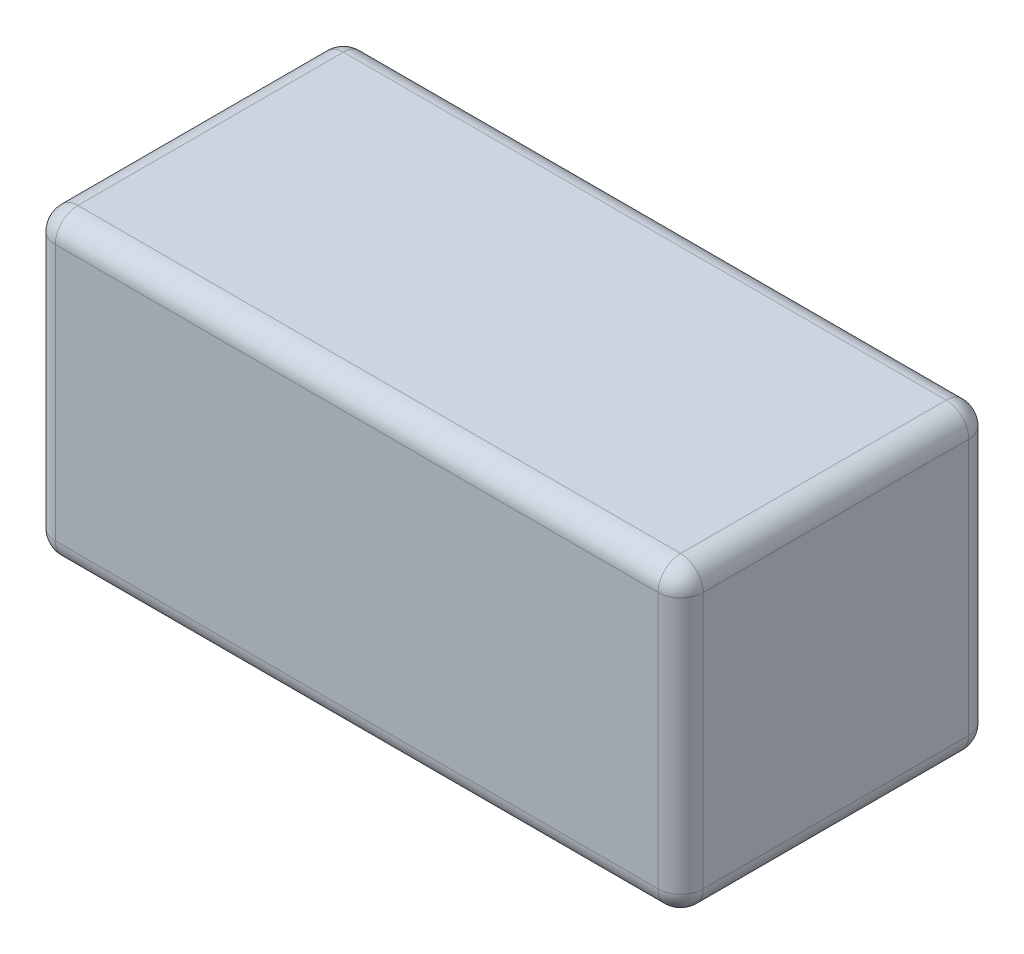
from build123d import *

# Parameters (mm, degrees)
SKETCH1_W           = 73
SKETCH1_H           = 34
BOSS_EXTRUDE1_DEPTH = 35
FILLET1_R           = 2.54


with BuildPart() as part:
    # Sketch1 → Boss-Extrude1 (new body)
    with BuildSketch(Plane.XY):
        Rectangle(SKETCH1_W, SKETCH1_H)
    extrude(amount=BOSS_EXTRUDE1_DEPTH)

    # Fillet1
    fillet1_edges = [part.edges().sort_by_distance(p)[0] for p in [
        (-36.5, 0, 0),
        (-36.5, -17, 17.5),
        (0, -17, 0),
        (36.5, -17, 17.5),
        (36.5, 0, 0),
        (36.5, 0, 35),
        (0, -17, 35),
        (-36.5, 0, 35),
        (36.5, 17, 17.5),
        (0, 17, 35),
        (-36.5, 17, 17.5),
        (0, 17, 0),
    ]]
    fillet(fillet1_edges, radius=FILLET1_R)


solid = part.part
